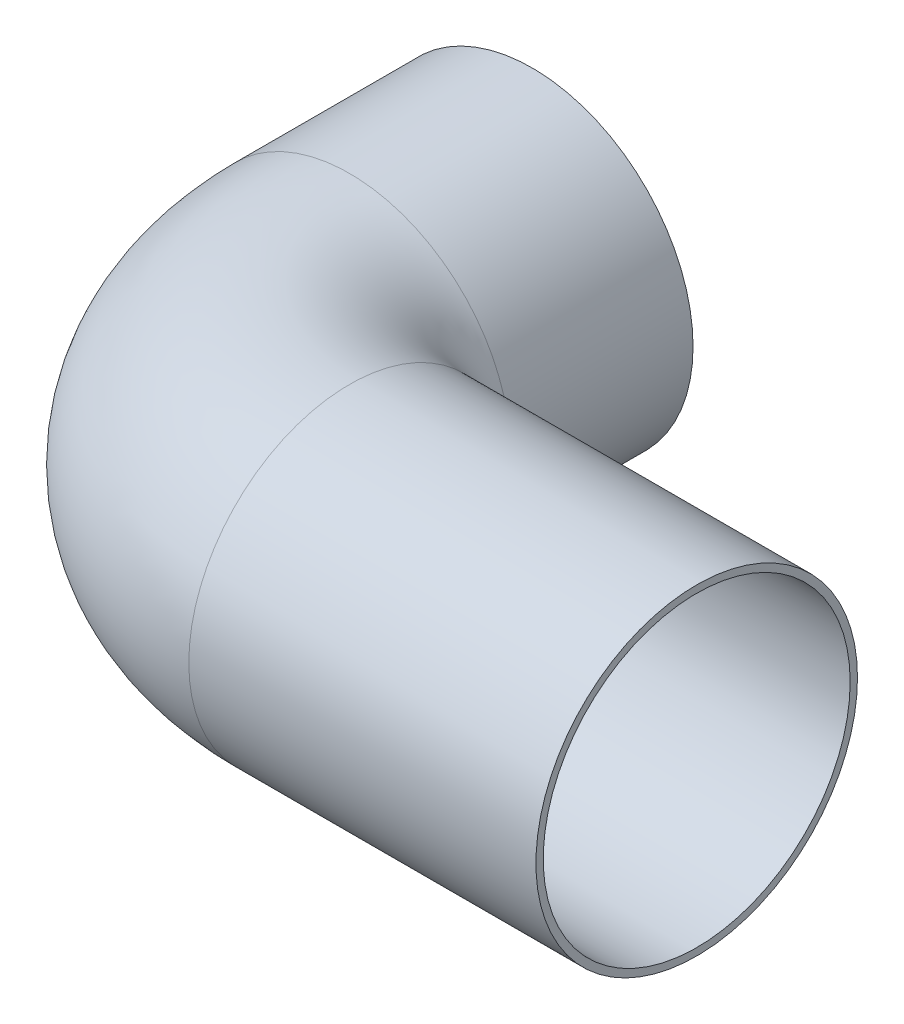
from build123d import *

# Parameters (mm, degrees)
SKETCH11_R   = 22
SKETCH11_R_2 = 21


with BuildPart() as part:
    # Sweep10: sweep along a path in Sketch9
    with BuildLine(Plane(origin=(0, 0, 0), x_dir=(1, 0, 0), z_dir=(0, 1, 0))) as sweep10_path:
        Line((22.5, 72.5), (22.5, 47.5))
        ThreePointArc((22.5, 47.5), (29.82233047, 29.82233047), (47.5, 22.5))
        Line((47.5, 22.5), (95, 22.5))
    # Sketch11 → Sweep10 (sweep)
    with BuildSketch(Plane(origin=(95, 0, -22.5), x_dir=(0, 0, -1), z_dir=(1, 0, 0))):
        Circle(SKETCH11_R)
        Circle(SKETCH11_R_2, mode=Mode.SUBTRACT)
    sweep(path=sweep10_path.line)


solid = part.part
